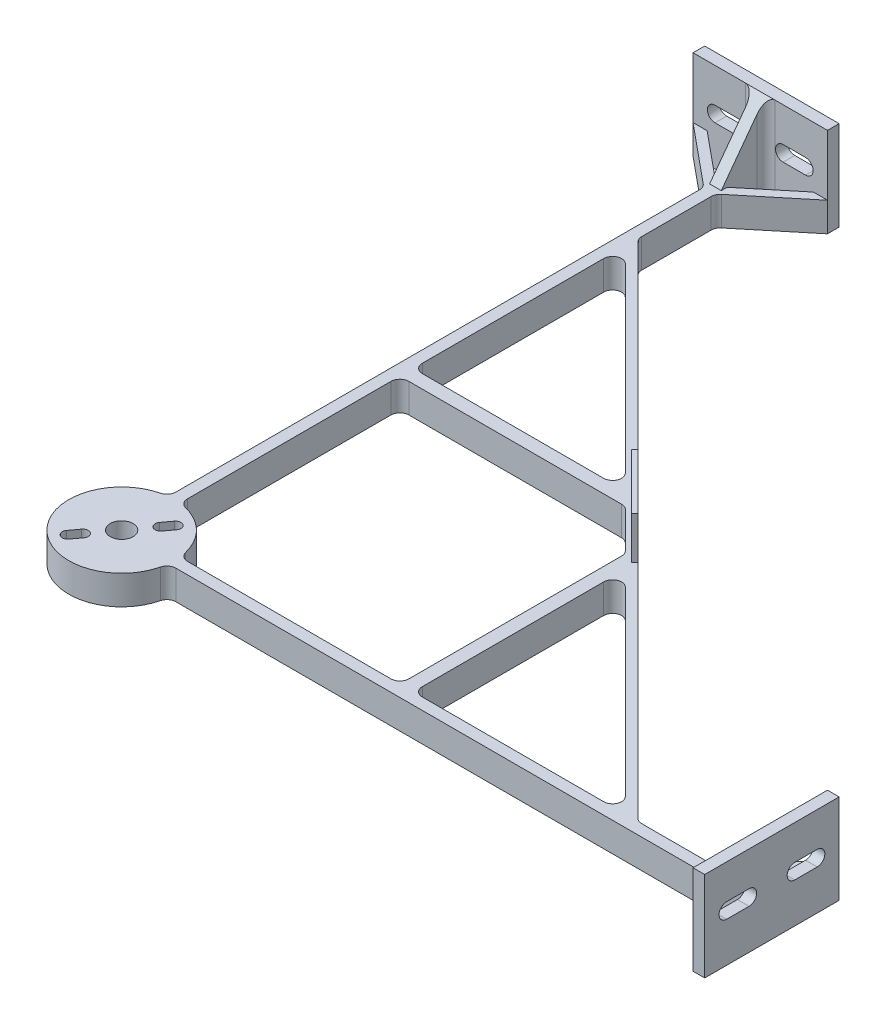
from build123d import *

# Parameters (mm, degrees)
SKETCH1_R           = 3.2385
BOSS_EXTRUDE1_DEPTH = 8.255
SKETCH3_W           = 3.302
SKETCH3_H           = 38.1
SKETCH3_W_2         = 38.1
SKETCH3_H_2         = 3.302
BOSS_EXTRUDE3_DEPTH = 25.4
BOSS_EXTRUDE4_DEPTH = 11.938
CUT_EXTRUDE1_DEPTH  = 276.581279586
SKETCH6_W           = 12.7
SKETCH6_H           = 3.302
BOSS_EXTRUDE5_DEPTH = 25.4
CUT_EXTRUDE2_DEPTH  = 25.4
SKETCH8_W           = 3.302
SKETCH8_H           = 12.7
BOSS_EXTRUDE6_DEPTH = 25.4
CUT_EXTRUDE3_DEPTH  = 25.4
FILLET1_R           = 2.54


with BuildPart() as part:
    # Sketch1 → Boss-Extrude1 (new body)
    with BuildSketch(Plane(origin=(0, 0, 0), x_dir=(1, 0, 0), z_dir=(0, 1, 0))):
        with BuildLine():
            Line((-1.651, 166.628963684), (-1.651, 14.89477744))
            ThreePointArc((-1.651, 14.89477744), (-10.596702223, -10.596702223), (14.89477744, -1.651))
            Line((14.89477744, -1.651), (166.628963684, -1.651))
            Line((166.628963684, -1.651), (180.975, -19.05))
            Line((180.975, -19.05), (180.975, -15.057345133))
            Line((180.975, -15.057345133), (169.921036316, -1.651))
            Line((169.921036316, -1.651), (180.975, -1.651))
            Line((180.975, -1.651), (180.975, 1.651))
            Line((180.975, 1.651), (169.921036316, 1.651))
            Line((169.921036316, 1.651), (180.975, 15.057345133))
            Line((180.975, 15.057345133), (180.975, 19.05))
            Line((180.975, 19.05), (166.628963684, 1.651))
            Line((166.628963684, 1.651), (144.671051224, 1.651))
            Line((144.671051224, 1.651), (1.651, 144.671051224))
            Line((1.651, 144.671051224), (1.651, 166.628963684))
            Line((1.651, 166.628963684), (19.05, 180.975))
            Line((19.05, 180.975), (15.057345133, 180.975))
            Line((15.057345133, 180.975), (1.651, 169.921036316))
            Line((1.651, 169.921036316), (1.651, 180.975))
            Line((1.651, 180.975), (-1.651, 180.975))
            Line((-1.651, 180.975), (-1.651, 169.921036316))
            Line((-1.651, 169.921036316), (-15.057345133, 180.975))
            Line((-15.057345133, 180.975), (-19.05, 180.975))
            Line((-19.05, 180.975), (-1.651, 166.628963684))
        make_face()
        with BuildLine():
            Line((-7.721732332, -7.873214705), (-5.908712478, -5.423058993))
            ThreePointArc((-5.908712478, -5.423058993), (-3.777124696, -5.104491065), (-3.458556767, -7.236078848))
            Line((-3.458556767, -7.236078848), (-5.271576621, -9.686234559))
            ThreePointArc((-5.271576621, -9.686234559), (-7.403164404, -10.004802487), (-7.721732332, -7.873214705))
        make_face(mode=Mode.SUBTRACT)
        Circle(SKETCH1_R, mode=Mode.SUBTRACT)
        with BuildLine():
            ThreePointArc((5.908712478, 5.423058993), (3.777124696, 5.104491065), (3.458556767, 7.236078848))
            Line((3.458556767, 7.236078848), (5.271576621, 9.686234559))
            ThreePointArc((5.271576621, 9.686234559), (7.403164404, 10.004802487), (7.721732332, 7.873214705))
            Line((7.721732332, 7.873214705), (5.908712478, 5.423058993))
        make_face(mode=Mode.SUBTRACT)
        with BuildLine():
            ThreePointArc((14.89477744, 1.651), (10.596702223, 10.596702223), (1.651, 14.89477744))
            Line((1.651, 14.89477744), (1.651, 77.202140867))
            Line((1.651, 77.202140867), (65.527807909, 77.202140867))
            Line((65.527807909, 77.202140867), (77.202140867, 65.527807909))
            Line((77.202140867, 65.527807909), (77.202140867, 1.651))
            Line((77.202140867, 1.651), (14.89477744, 1.651))
        make_face(mode=Mode.SUBTRACT)
        Polygon((141.078948776, 1.651), (81.012140867, 1.651), (81.012140867, 61.717807909), align=None, mode=Mode.SUBTRACT)
        Polygon((1.651, 81.012140867), (1.651, 141.078948776), (61.717807909, 81.012140867), align=None, mode=Mode.SUBTRACT)
    extrude(amount=BOSS_EXTRUDE1_DEPTH)

    # Sketch3 → Boss-Extrude3 (add)
    with BuildSketch(Plane(origin=(0, 0, 0), x_dir=(1, 0, 0), z_dir=(0, 1, 0))):
        with Locations((182.626, 0)):
            Rectangle(SKETCH3_W, SKETCH3_H)
        with Locations((0, 182.626)):
            Rectangle(SKETCH3_W_2, SKETCH3_H_2)
    extrude(amount=BOSS_EXTRUDE3_DEPTH)

    # Sketch4 → Boss-Extrude4 (add)
    with BuildSketch(Plane(origin=(0, 8.255, 0), x_dir=(1, 0, 0), z_dir=(0, 1, 0))):
        Polygon((65.258400226, 81.063650999), (64.360374613, 80.165625387), (80.165625387, 64.360374613), (81.063650999, 65.258400226), align=None)
    extrude(amount=BOSS_EXTRUDE4_DEPTH)

    # Sketch5 → Cut-Extrude1 (cut, through all)
    with BuildSketch(Plane(origin=(184.277, 0, 0), x_dir=(0, 0, -1), z_dir=(1, 0, 0))):
        with BuildLine():
            Line((-12.827, 15.63160537), (-6.477, 15.63160537))
            ThreePointArc((-6.477, 15.63160537), (-4.318, 13.47260537), (-6.477, 11.31360537))
            Line((-6.477, 11.31360537), (-12.827, 11.31360537))
            ThreePointArc((-12.827, 11.31360537), (-14.986, 13.47260537), (-12.827, 15.63160537))
        make_face()
        with BuildLine():
            Line((12.827, 15.63160537), (6.477, 15.63160537))
            ThreePointArc((6.477, 15.63160537), (4.318, 13.47260537), (6.477, 11.31360537))
            Line((6.477, 11.31360537), (12.827, 11.31360537))
            ThreePointArc((12.827, 11.31360537), (14.986, 13.47260537), (12.827, 15.63160537))
        make_face()
    cut_extrude1 = extrude(amount=-CUT_EXTRUDE1_DEPTH, mode=Mode.SUBTRACT)

    # Mirror1: Cut-Extrude1 across plane
    add(cut_extrude1.mirror(Plane(origin=(0, 0, 0), x_dir=(-0.7071067811865585, 0, 0.7071067811865367), z_dir=(0.7071067811865366, 0, 0.7071067811865585))), mode=Mode.SUBTRACT)

    # Sketch6 → Boss-Extrude5 (add)
    with BuildSketch(Plane(origin=(0, 0, 0), x_dir=(1, 0, 0), z_dir=(0, 1, 0))):
        with Locations((174.625, 0)):
            Rectangle(SKETCH6_W, SKETCH6_H)
    extrude(amount=BOSS_EXTRUDE5_DEPTH)

    # Sketch7 → Cut-Extrude2 (cut)
    with BuildSketch(Plane(origin=(0, 0, -1.651), x_dir=(-1, 0, 0), z_dir=(0, 0, -1))):
        Polygon((-180.975, 25.4), (-168.275, 8.255), (-168.275, 25.4), align=None)
    extrude(amount=-CUT_EXTRUDE2_DEPTH, mode=Mode.SUBTRACT)

    # Sketch8 → Boss-Extrude6 (add)
    with BuildSketch(Plane(origin=(0, 0, 0), x_dir=(1, 0, 0), z_dir=(0, 1, 0))):
        with Locations((0, 174.625)):
            Rectangle(SKETCH8_W, SKETCH8_H)
    extrude(amount=BOSS_EXTRUDE6_DEPTH)

    # Sketch9 → Cut-Extrude3 (cut)
    with BuildSketch(Plane(origin=(1.651, 0, 0), x_dir=(0, 0, -1), z_dir=(1, 0, 0))):
        Polygon((180.975, 25.4), (168.275, 8.255), (168.275, 25.4), align=None)
    extrude(amount=-CUT_EXTRUDE3_DEPTH, mode=Mode.SUBTRACT)

    # Fillet1
    fillet1_edges = [part.edges().sort_by_distance(p)[0] for p in [
        (180.975, 12.7, 1.651),
        (-1.651, 12.7, -180.975),
        (141.078948776, 4.1275, -1.651),
        (61.717807909, 4.1275, -81.012140867),
        (1.651, 4.1275, -141.078948776),
        (81.012140867, 4.1275, -61.717807909),
        (14.89477744, 4.1275, 1.651),
        (-1.651, 4.1275, -14.89477744),
        (180.975, 12.7, -1.651),
        (77.202140867, 4.1275, -1.651),
        (1.651, 12.7, -180.975),
        (1.651, 4.1275, -77.202140867),
        (166.628963684, 4.1275, 1.651),
        (65.527807909, 4.1275, -77.202140867),
        (-1.651, 4.1275, -166.628963684),
        (77.202140867, 4.1275, -65.527807909),
        (1.651, 4.1275, -166.628963684),
        (1.651, 4.1275, -14.89477744),
        (1.651, 4.1275, -144.671051224),
        (1.651, 4.1275, -81.012140867),
        (81.012140867, 4.1275, -1.651),
        (166.628963684, 4.1275, -1.651),
        (14.89477744, 4.1275, -1.651),
        (144.671051224, 4.1275, -1.651),
    ]]
    fillet(fillet1_edges, radius=FILLET1_R)


solid = part.part
